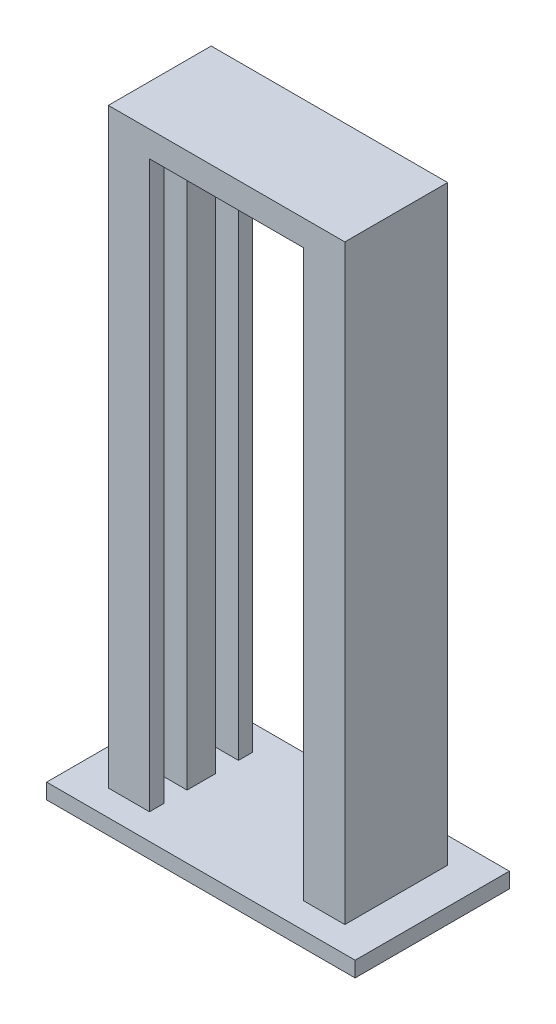
from build123d import *

# Parameters (mm, degrees)
SKETCH1_W           = 60
SKETCH1_H           = 30
BOSS_EXTRUDE1_DEPTH = 3
SKETCH2_W           = 8
SKETCH2_H           = 20
BOSS_EXTRUDE2_DEPTH = 110
SKETCH3_W           = 5.5
SKETCH3_H           = 4.5
CUT_EXTRUDE1_DEPTH  = 110
SKETCH4_W           = 46
SKETCH4_H           = 20
BOSS_EXTRUDE3_DEPTH = 5


with BuildPart() as part:
    # Sketch1 → Boss-Extrude1 (new body)
    with BuildSketch(Plane(origin=(0, 0, 0), x_dir=(1, 0, 0), z_dir=(0, 1, 0))):
        Rectangle(SKETCH1_W, SKETCH1_H)
    extrude(amount=BOSS_EXTRUDE1_DEPTH)

    # Sketch2 → Boss-Extrude2 (add)
    with BuildSketch(Plane(origin=(0, 3, 0), x_dir=(1, 0, 0), z_dir=(0, 1, 0))):
        with Locations((19, 0)):
            Rectangle(SKETCH2_W, SKETCH2_H)
        with Locations((-19, 0)):
            Rectangle(SKETCH2_W, SKETCH2_H)
    extrude(amount=BOSS_EXTRUDE2_DEPTH)

    # Sketch3 → Cut-Extrude1 (cut)
    with BuildSketch(Plane(origin=(0, 113, 0), x_dir=(1, 0, 0), z_dir=(0, 1, 0))):
        with Locations((-17.75, 5.060211211)):
            Rectangle(SKETCH3_W, SKETCH3_H)
        with Locations((-17.75, -4.939788789)):
            Rectangle(SKETCH3_W, SKETCH3_H)
        with Locations((17.75, -4.939788789)):
            Rectangle(SKETCH3_W, SKETCH3_H)
        with Locations((17.75, 5.060211211)):
            Rectangle(SKETCH3_W, SKETCH3_H)
    extrude(amount=-CUT_EXTRUDE1_DEPTH, mode=Mode.SUBTRACT)

    # Sketch4 → Boss-Extrude3 (add)
    with BuildSketch(Plane(origin=(0, 113, 0), x_dir=(1, 0, 0), z_dir=(0, 1, 0))):
        Rectangle(SKETCH4_W, SKETCH4_H)
    extrude(amount=BOSS_EXTRUDE3_DEPTH)


solid = part.part
